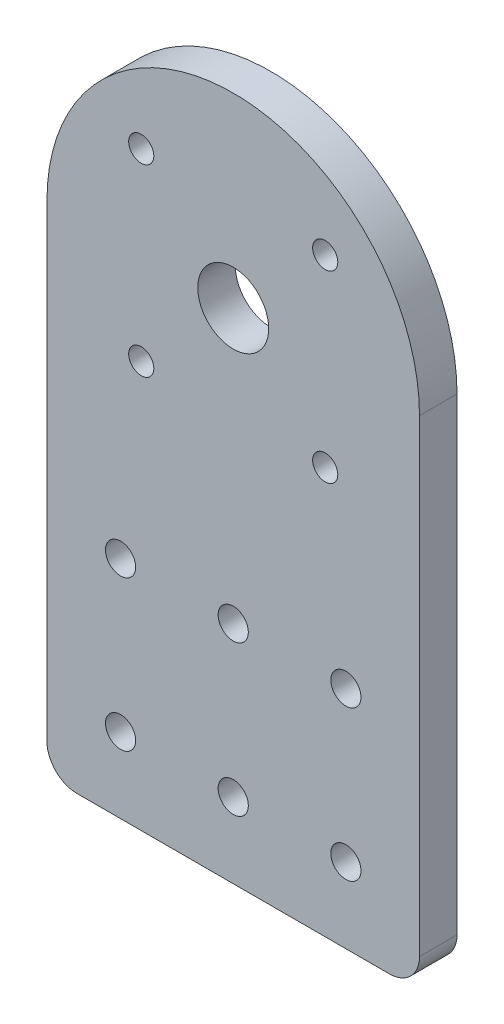
from build123d import *

# Parameters (mm, degrees)
SKETCH1_R           = 2.125
SKETCH1_R_2         = 2.5527
SKETCH1_R_3         = 6
BOSS_EXTRUDE1_DEPTH = 6.35
FILLET1_R           = 5.08


with BuildPart() as part:
    # Sketch1 → Boss-Extrude1 (new body)
    with BuildSketch(Plane.XY):
        with BuildLine():
            Line((31.499999992, 0), (31.499999992, 84.3))
            ThreePointArc((31.499999992, 84.3), (0, 115.799999992), (-31.499999992, 84.3))
            Line((-31.499999992, 84.3), (-31.499999992, 0))
            Line((-31.499999992, 0), (31.499999992, 0))
        make_face()
        with Locations((-15.556349186, 99.856349186)):
            Circle(SKETCH1_R, mode=Mode.SUBTRACT)
        with Locations((15.556349186, 99.856349186)):
            Circle(SKETCH1_R, mode=Mode.SUBTRACT)
        with Locations((15.556349186, 68.743650814)):
            Circle(SKETCH1_R, mode=Mode.SUBTRACT)
        with Locations((-15.556349186, 68.743650814)):
            Circle(SKETCH1_R, mode=Mode.SUBTRACT)
        with Locations((19.05, 12.7)):
            Circle(SKETCH1_R_2, mode=Mode.SUBTRACT)
        with Locations((0, 12.7)):
            Circle(SKETCH1_R_2, mode=Mode.SUBTRACT)
        with Locations((0, 38.1)):
            Circle(SKETCH1_R_2, mode=Mode.SUBTRACT)
        with Locations((19.05, 38.1)):
            Circle(SKETCH1_R_2, mode=Mode.SUBTRACT)
        with Locations((-19.05, 12.7)):
            Circle(SKETCH1_R_2, mode=Mode.SUBTRACT)
        with Locations((-19.05, 38.1)):
            Circle(SKETCH1_R_2, mode=Mode.SUBTRACT)
        with Locations((0, 84.3)):
            Circle(SKETCH1_R_3, mode=Mode.SUBTRACT)
    extrude(amount=BOSS_EXTRUDE1_DEPTH)

    # Fillet1
    fillet1_edges = [part.edges().sort_by_distance(p)[0] for p in [
        (-31.499999992, 0, 3.175),
        (31.499999992, 0, 3.175),
    ]]
    fillet(fillet1_edges, radius=FILLET1_R)


solid = part.part
